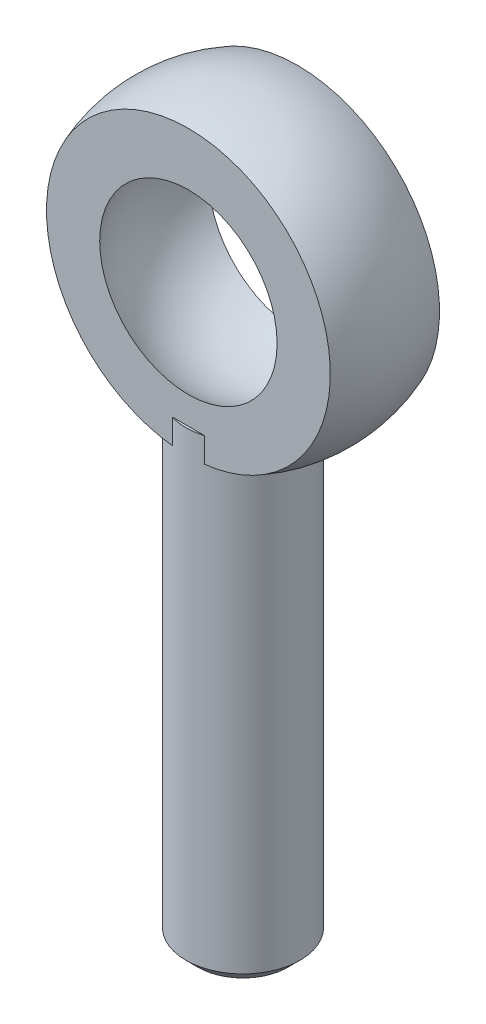
from build123d import *

# Parameters (mm, degrees)
EXTRUDE2_DEPTH      = 3
EXTRUDE2_DEPTH_BACK = 36.53
SKETCH5_R           = 4.7625
CHAMFER1_SIZE       = 1


with BuildPart() as part:
    # Sketch3 → Revolve2 (revolve)
    with BuildSketch(Plane(origin=(0, 0, 0), x_dir=(0, 0, -1), z_dir=(1, 0, 0))):
        with BuildLine():
            Line((-4.56, 11.853117733), (-4.56, 0))
            Line((-4.56, 0), (4.56, 0))
            Line((4.56, 0), (4.56, 11.853117733))
            ThreePointArc((4.56, 11.853117733), (0, 12.7), (-4.56, 11.853117733))
        make_face()
    revolve(axis=Axis((0, 0, 8.146649187), (0, 0, -1)))

    # Sketch2 → Cut-Revolve2 (revolve, cut)
    with BuildSketch(Plane(origin=(0, 0, 0), x_dir=(0, 0, -1), z_dir=(1, 0, 0))):
        with BuildLine():
            Line((0, 8.7), (0, -8.7))
            ThreePointArc((0, -8.7), (8.7, 0), (0, 8.7))
        make_face()
    revolve(axis=Axis((0, 15.474361319, 0), (0, -1, 0)), mode=Mode.SUBTRACT)


with BuildPart() as body_2:
    # Sketch5 → Extrude2 (new, two sides: drawn at the far end of the back side and taken through both)
    with BuildSketch(Plane(origin=(0, -12.7, 0), x_dir=(-1, 0, 0), z_dir=(0, 1, 0)).offset(-EXTRUDE2_DEPTH_BACK)):
        Circle(SKETCH5_R)
    extrude(amount=EXTRUDE2_DEPTH + EXTRUDE2_DEPTH_BACK)

    # Chamfer1
    chamfer1_edges = [body_2.edges().sort_by_distance(p)[0] for p in [
        (4.7625, -49.23, 0),
    ]]
    chamfer(chamfer1_edges, length=CHAMFER1_SIZE)


solid = Compound([part.part, body_2.part])
